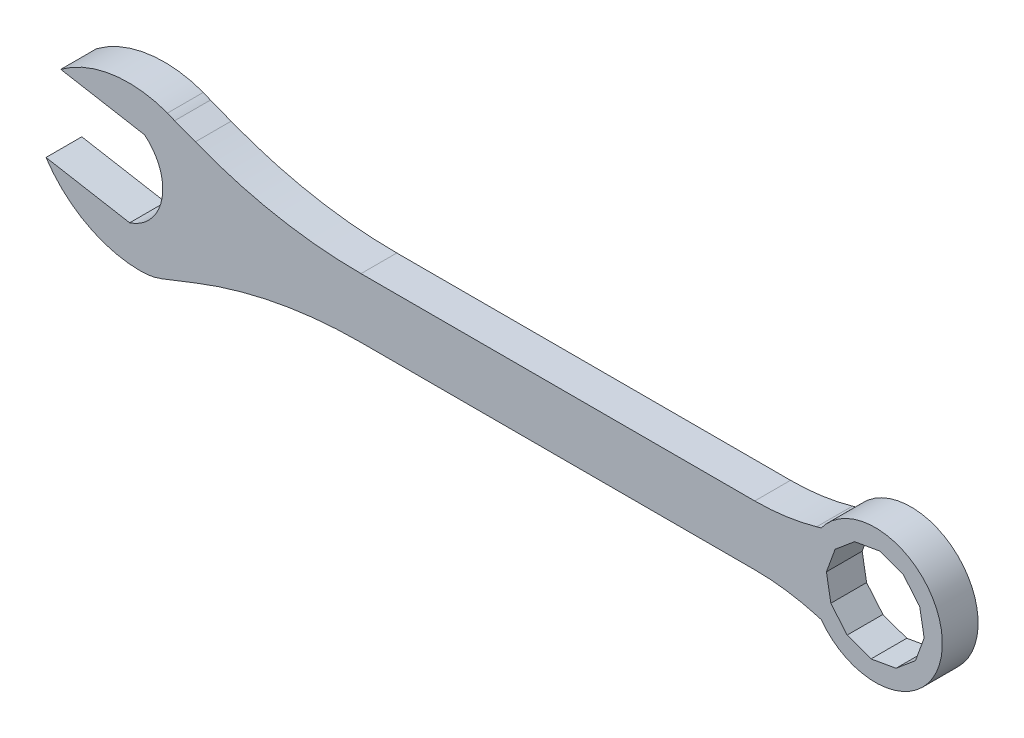
from build123d import *

# Parameters (mm, degrees)
BOSS_EXTRUDE1_DEPTH = 4
BOSS_EXTRUDE2_DEPTH = 4
SKETCH3_R           = 15
BOSS_EXTRUDE3_DEPTH = 4
CUT_EXTRUDE1_DEPTH  = 182.142010033


with BuildPart() as part:
    # Sketch1 → Boss-Extrude1 (new, symmetric)
    with BuildSketch(Plane(origin=(0, 0, 0), x_dir=(1, 0, 0), z_dir=(0, 0, -1))):
        with BuildLine():
            ThreePointArc((0.888659559, 17.490810401), (-11.180749156, 14.458169872), (-20.361004995, 6.056358278))
            Line((-20.361004995, 6.056358278), (-1.649657688, 9.355673654))
            ThreePointArc((-1.649657688, 9.355673654), (5.590356067, 0.985730606), (1.649657688, -9.355673654))
            Line((1.649657688, -9.355673654), (-17.061689619, -12.654989029))
            ThreePointArc((-17.061689619, -12.654989029), (-5.561482145, -17.410276968), (6.81727631, -16.132045995))
            ThreePointArc((6.81727631, -16.132045995), (12.115123172, -12.451568176), (14.921381349, -6.643124891))
            ThreePointArc((14.921381349, -6.643124891), (15.008470156, 2.646398228), (11.749429419, 11.345908427))
            ThreePointArc((11.749429419, 11.345908427), (7.125804713, 15.844262895), (0.888659559, 17.490810401))
        make_face()
    extrude(amount=BOSS_EXTRUDE1_DEPTH, both=True)

    # Sketch2 → Boss-Extrude2 (add, symmetric)
    with BuildSketch(Plane(origin=(0, 0, 0), x_dir=(1, 0, 0), z_dir=(0, 0, -1))):
        with BuildLine():
            Line((138.145833398, 6.6675), (50.091152373, 6.6675))
            ThreePointArc((50.091152373, 6.6675), (31.236869984, 8.432255544), (13.037571835, 13.665215834))
            Line((13.037571835, 13.665215834), (5.503588891, 16.616106991))
            ThreePointArc((5.503588891, 16.616106991), (9.061997913, 14.49711603), (11.749429419, 11.345908427))
            ThreePointArc((11.749429419, 11.345908427), (15.008470156, 2.646398228), (14.921381349, -6.643124891))
            ThreePointArc((14.921381349, -6.643124891), (12.65449417, -11.774613247), (8.398038281, -15.428861939))
            Line((8.398038281, -15.428861939), (13.037571835, -13.665215834))
            ThreePointArc((13.037571835, -13.665215834), (31.236869984, -8.432255544), (50.091152373, -6.6675))
            Line((50.091152373, -6.6675), (138.145833398, -6.6675))
            ThreePointArc((138.145833398, -6.6675), (145.136444423, -7.150789481), (151.994044079, -8.591462303))
            Line((151.994044079, -8.591462303), (164.253588891, -12.065))
            Line((164.253588891, -12.065), (164.253588891, 12.065))
            Line((164.253588891, 12.065), (151.994044079, 8.591462303))
            ThreePointArc((151.994044079, 8.591462303), (145.136444423, 7.150789481), (138.145833398, 6.6675))
        make_face()
    extrude(amount=BOSS_EXTRUDE2_DEPTH, both=True)

    # Sketch3 → Boss-Extrude3 (add, symmetric)
    with BuildSketch(Plane.XY):
        with Locations((165.1, 0)):
            Circle(SKETCH3_R)
    extrude(amount=BOSS_EXTRUDE3_DEPTH, both=True)

    # Sketch4 → Cut-Extrude1 (cut, through all)
    with BuildSketch(Plane(origin=(0, 0, 4), x_dir=(0.9848077530122081, 0.1736481776669307, 0), z_dir=(0, 0, 1))):
        Polygon((154.835152186, -36.425921969), (159.752644507, -39.265037484), (165.430875538, -39.265037484), (170.348367859, -36.425921969), (173.187483374, -31.508429648), (173.187483374, -25.830198618), (170.348367859, -20.912706297), (165.430875538, -18.073590781), (159.752644507, -18.073590781), (154.835152186, -20.912706297), (151.996036671, -25.830198618), (151.996036671, -31.508429648), align=None)
    extrude(amount=-CUT_EXTRUDE1_DEPTH, mode=Mode.SUBTRACT)


solid = part.part
